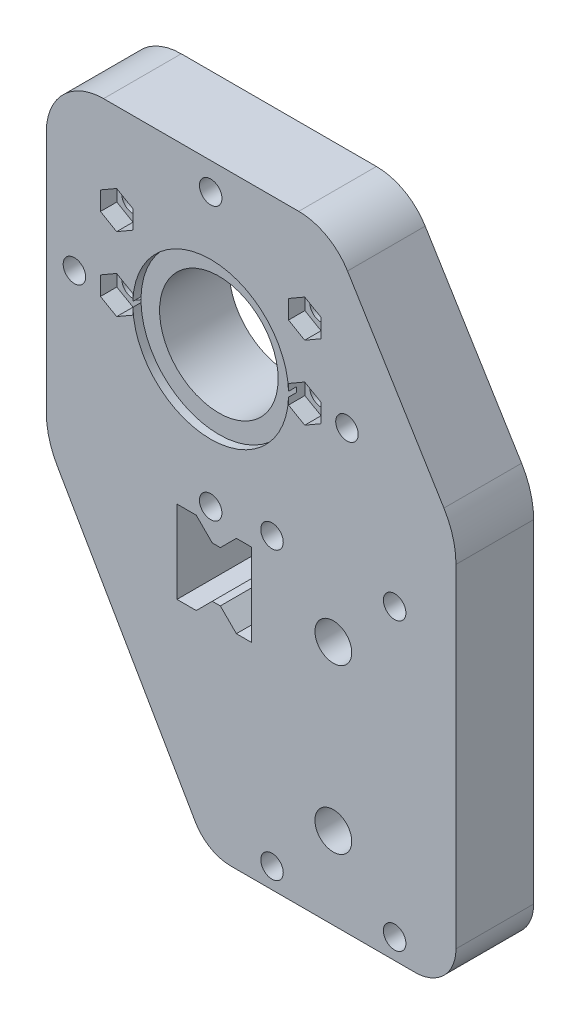
from build123d import *

# Parameters (mm, degrees)
BOSS_EXTRUDE1_DEPTH  = 19
FILLET1_R            = 10
BOSS_EXTRUDE2_DEPTH  = 19
SKETCH2_R            = 14.5
CUT_EXTRUDE1_DEPTH   = 20
M5_CLEARANCE_HOLE2_D = 5.5
M5_CLEARANCE_HOLE1_D = 5.5
M5_CLEARANCE_HOLE3_D = 5.5
M8_CLEARANCE_HOLE1_D = 9
CUT_EXTRUDE2_DEPTH   = 4
CUT_EXTRUDE3_DEPTH   = 4
SKETCH16_R           = 19.05
CUT_EXTRUDE4_DEPTH   = 2
CUT_EXTRUDE5_DEPTH   = 20


# Read off the part's stored shape, not the designer's step: Boss-Extrude2
with BuildPart() as part:
    # Sketch1 → Boss-Extrude1 (new body)
    with BuildSketch(Plane.XY):
        with BuildLine():
            Line((-170.200000001, 540.824594888), (-129.309401077, 470))
            Line((-129.309401077, 470), (-93, 470))
            ThreePointArc((-93, 470), (-90.878679656, 470.878679656), (-90, 473))
            Line((-90, 473), (-90, 564.25527297))
            Line((-90, 564.25527297), (-116.225329238, 607))
            Line((-116.225329238, 607), (-170.200000001, 607))
            Line((-170.200000001, 607), (-170.200000001, 540.824594888))
        make_face()
    extrude(amount=BOSS_EXTRUDE1_DEPTH)

    # Fillet1
    fillet1_edges = [part.edges().sort_by_distance(p)[0] for p in [
        (-90, 564.25527297, 9.5),
        (-129.309401077, 470, 9.5),
        (-170.200000001, 540.824594888, 9.5),
    ]]
    fillet(fillet1_edges, radius=FILLET1_R)

    # Boss-Extrude2 outline → Boss-Extrude2 (add)
    with BuildSketch(Plane.XY):
        with BuildLine():
            Line((-93, 470), (-90, 470))
            ThreePointArc((-90, 470), (-82.928932188, 472.928932188), (-80, 480))
            Line((-80, 480), (-80, 561.432106106))
            ThreePointArc((-80, 561.432106106), (-80.75234172, 566.866041212), (-82.952765074, 571.89115871))
            Line((-82.952765074, 571.89115871), (-106.530973281, 610.321336823))
            ThreePointArc((-106.530973281, 610.321336823), (-111.626593598, 615.216765438), (-118.464037729, 617))
            Line((-118.464037729, 617), (-166.200000001, 617))
            ThreePointArc((-166.200000001, 617), (-176.099494937, 612.899494936), (-180.200000001, 603))
            Line((-180.200000001, 603), (-180.200000001, 543.504086813))
            ThreePointArc((-180.200000001, 543.504086813), (-179.518516526, 538.327705911), (-177.520508076, 533.504086813))
            Line((-177.520508076, 533.504086813), (-143.743157806, 475))
            ThreePointArc((-143.743157806, 475), (-140.082903769, 471.339745962), (-135.082903769, 470))
            Line((-135.082903769, 470), (-123.535898385, 470))
            ThreePointArc((-123.535898385, 470), (-128.535898385, 471.339745962), (-132.196152423, 475))
            Line((-132.196152423, 475), (-168.860254039, 538.504086813))
            ThreePointArc((-168.860254039, 538.504086813), (-169.859258264, 540.915896362), (-170.200000001, 543.504086813))
            Line((-170.200000001, 543.504086813), (-170.200000001, 607))
            Line((-170.200000001, 607), (-116.225329238, 607))
            Line((-116.225329238, 607), (-91.476382537, 566.661632408))
            ThreePointArc((-91.476382537, 566.661632408), (-90.37617086, 564.149073659), (-90, 561.432106106))
            Line((-90, 561.432106106), (-90, 473))
            ThreePointArc((-90, 473), (-90.878679656, 470.878679656), (-93, 470))
        make_face()
    extrude(amount=BOSS_EXTRUDE2_DEPTH)

    # Sketch2 → Cut-Extrude1 (cut)
    with BuildSketch(Plane.XY.offset(19)):
        with Locations((-140, 577)):
            Circle(SKETCH2_R)
    extrude(amount=-CUT_EXTRUDE1_DEPTH, mode=Mode.SUBTRACT)

    # M5 Clearance Hole2 (through all)
    with Locations(Plane(origin=(0, 0, 0), x_dir=(-1, 0, 0), z_dir=(0, 0, -1))):
        with Locations((117.000000001, 595), (117.000000001, 577), (163.000000001, 577), (163.000000001, 595)):
            Hole(M5_CLEARANCE_HOLE2_D / 2)

    # M5 Clearance Hole1 (through all)
    with Locations(Plane.XY.offset(19)):
        with Locations((-95, 545), (-125, 545), (-125, 475), (-95, 475), (-110, 490), (-110, 530)):
            Hole(M5_CLEARANCE_HOLE1_D / 2)

    # M5 Clearance Hole3 (through all)
    with Locations(Plane.XY.offset(19)):
        with Locations((-140.000000001, 543.666986335), (-173.333013666, 577), (-106.666986336, 577), (-140.000000001, 610.333013665)):
            Hole(M5_CLEARANCE_HOLE3_D / 2)

    # M8 Clearance Hole1 (through all)
    with Locations(Plane(origin=(-110, 490, 0), x_dir=(-1, 0, 0), z_dir=(0, 0, -1))):
        with Locations((0, 0), (0, 40)):
            Hole(M8_CLEARANCE_HOLE1_D / 2)

    # Sketch14 → Cut-Extrude2 (cut)
    with BuildSketch(Plane(origin=(0, 0, 19), x_dir=(-1, 0, 0), z_dir=(0, 0, -1))):
        Polygon((117.000000001, 581.572614132), (113.04, 579.286307066), (113.04, 574.713692934), (117.000000001, 572.427385868), (120.960000001, 574.713692934), (120.960000001, 579.286307066), align=None)
        Polygon((163.000000001, 581.572614133), (159.04, 579.286307066), (159.04, 574.713692934), (163.000000001, 572.427385867), (166.960000001, 574.713692934), (166.960000001, 579.286307066), align=None)
        Polygon((163.000000001, 599.572614132), (159.040000001, 597.286307066), (159.040000001, 592.713692934), (163.000000001, 590.427385868), (166.960000001, 592.713692934), (166.960000001, 597.286307066), align=None)
        Polygon((120.960000001, 597.286307066), (117.000000001, 599.572614132), (113.040000001, 597.286307066), (113.040000001, 592.713692934), (117.000000001, 590.427385868), (120.960000001, 592.713692934), align=None)
    extrude(amount=CUT_EXTRUDE2_DEPTH, mode=Mode.SUBTRACT)

    # Sketch15 → Cut-Extrude3 (cut)
    with BuildSketch(Plane.XY):
        Polygon((-143.233326461, 546.900312795), (-144.416806085, 542.483506711), (-141.183479624, 539.25018025), (-136.76667354, 540.433659874), (-135.583193916, 544.850465958), (-138.816520377, 548.083792419), align=None)
        Polygon((-143.233326462, 613.566340126), (-144.416806085, 609.149534041), (-141.183479624, 605.91620758), (-136.76667354, 607.099687204), (-135.583193916, 611.516493288), (-138.816520377, 614.749819749), align=None)
        Polygon((-109.900312796, 580.23332646), (-111.083792419, 575.816520376), (-107.850465959, 572.583193916), (-103.433659875, 573.766673539), (-102.250180252, 578.183479623), (-105.483506712, 581.416806083), align=None)
        Polygon((-172.149534042, 581.416806083), (-176.566340126, 580.23332646), (-177.749819749, 575.816520376), (-174.516493289, 572.583193916), (-170.099687205, 573.766673539), (-168.916207582, 578.183479623), align=None)
    extrude(amount=CUT_EXTRUDE3_DEPTH, mode=Mode.SUBTRACT)

    # Sketch16 → Cut-Extrude4 (cut)
    with BuildSketch(Plane.XY.offset(19)):
        with Locations((-140, 577)):
            Circle(SKETCH16_R)
    extrude(amount=-CUT_EXTRUDE4_DEPTH, mode=Mode.SUBTRACT)

    # Sketch17 → Cut-Extrude5 (cut)
    with BuildSketch(Plane.XY.offset(19)):
        Polygon((-148.25, 540.1), (-148.25, 519.9), (-143.533578644, 519.9), (-139.608578644, 523.825), (-137.641421356, 523.825), (-133.716421356, 519.9), (-130, 519.9), (-130, 540.1), (-133.716421356, 540.1), (-137.641421356, 536.175), (-139.608578644, 536.175), (-143.533578644, 540.1), align=None)
    extrude(amount=-CUT_EXTRUDE5_DEPTH, mode=Mode.SUBTRACT)


solid = part.part
